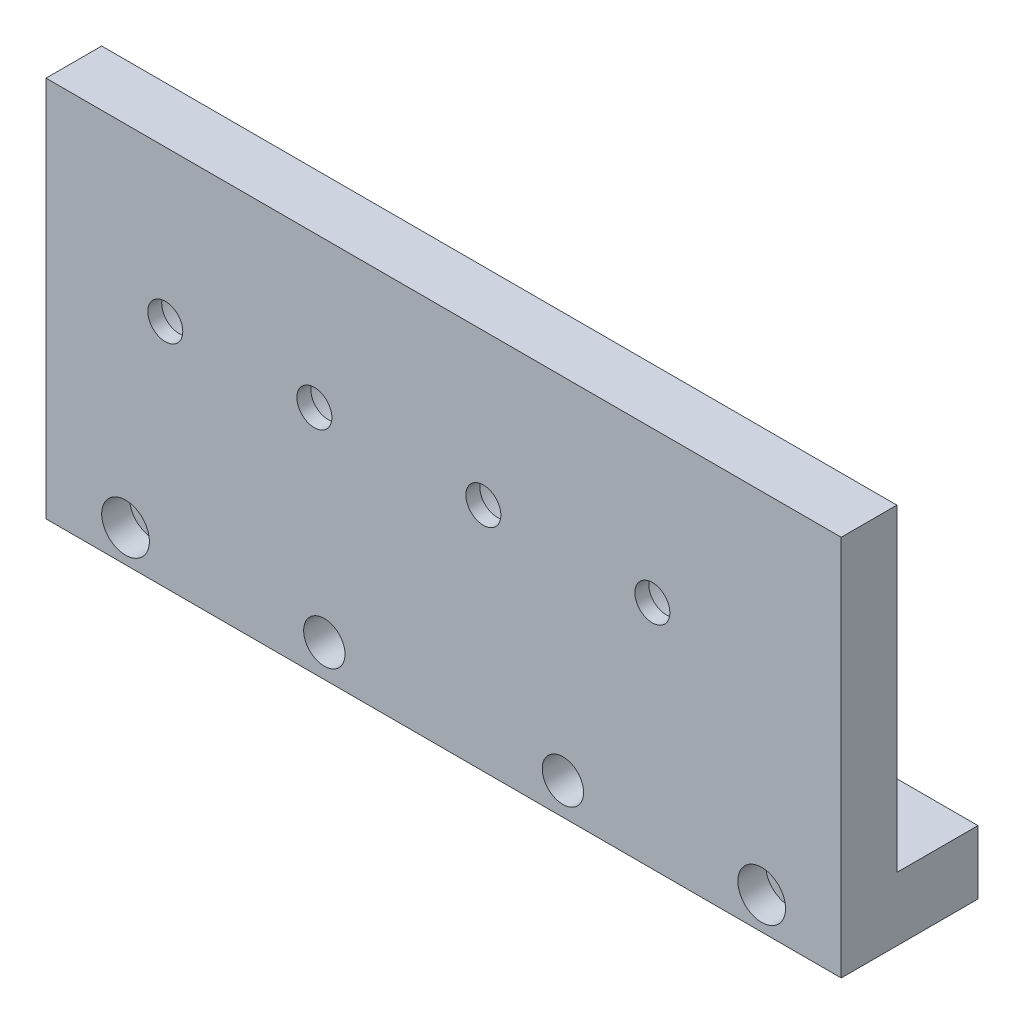
from build123d import *

# Parameters (mm, degrees)
SKETCH1_W           = 100
SKETCH1_H           = 48
BOSS_EXTRUDE1_DEPTH = 7
CUT_EXTRUDE1_REACH  = 113.144
SKETCH2_R           = 2.2
SKETCH3_W           = 100
SKETCH3_H           = 8
BOSS_EXTRUDE2_DEPTH = 10.2
SKETCH4_R           = 6.6
CUT_EXTRUDE2_DEPTH  = 5.25
SKETCH5_R           = 2.6
CUT_EXTRUDE3_DEPTH  = 7
SKETCH7_R           = 1.5
CUT_EXTRUDE4_DEPTH  = 112.391382072
CUT_EXTRUDE5_REACH  = 114.249
SKETCH8_R           = 1.7
SKETCH9_R           = 3
CUT_EXTRUDE6_DEPTH  = 3.5


with BuildPart() as part:
    # Sketch1 → Boss-Extrude1 (new body)
    with BuildSketch(Plane.XY):
        with Locations((50, 24)):
            Rectangle(SKETCH1_W, SKETCH1_H)
    extrude(amount=BOSS_EXTRUDE1_DEPTH)

    # Sketch2 → Cut-Extrude1 (cut, up to next)
    with BuildSketch(Plane.XY.offset(7), mode=Mode.PRIVATE) as cut_extrude1_sk1:
        with Locations((15, 29)):
            Circle(SKETCH2_R)
    cut_extrude1_tool1 = extrude(cut_extrude1_sk1.sketch, amount=-CUT_EXTRUDE1_REACH, mode=Mode.PRIVATE) & part.part
    # Sketch2 → Cut-Extrude1 (cut, up to next)
    with BuildSketch(Plane.XY.offset(7), mode=Mode.PRIVATE) as cut_extrude1_sk2:
        with Locations((33.75, 29)):
            Circle(SKETCH2_R)
    cut_extrude1_tool2 = extrude(cut_extrude1_sk2.sketch, amount=-CUT_EXTRUDE1_REACH, mode=Mode.PRIVATE) & part.part
    # Sketch2 → Cut-Extrude1 (cut, up to next)
    with BuildSketch(Plane.XY.offset(7), mode=Mode.PRIVATE) as cut_extrude1_sk3:
        with Locations((55, 29)):
            Circle(SKETCH2_R)
    cut_extrude1_tool3 = extrude(cut_extrude1_sk3.sketch, amount=-CUT_EXTRUDE1_REACH, mode=Mode.PRIVATE) & part.part
    # Sketch2 → Cut-Extrude1 (cut, up to next)
    with BuildSketch(Plane.XY.offset(7), mode=Mode.PRIVATE) as cut_extrude1_sk4:
        with Locations((76.25, 29)):
            Circle(SKETCH2_R)
    cut_extrude1_tool4 = extrude(cut_extrude1_sk4.sketch, amount=-CUT_EXTRUDE1_REACH, mode=Mode.PRIVATE) & part.part
    add(cut_extrude1_tool1.solids().sort_by_distance((15, 29, 7))[0], mode=Mode.SUBTRACT)
    add(cut_extrude1_tool2.solids().sort_by_distance((33.75, 29, 7))[0], mode=Mode.SUBTRACT)
    add(cut_extrude1_tool3.solids().sort_by_distance((55, 29, 7))[0], mode=Mode.SUBTRACT)
    add(cut_extrude1_tool4.solids().sort_by_distance((76.25, 29, 7))[0], mode=Mode.SUBTRACT)

    # Sketch3 → Boss-Extrude2 (add)
    with BuildSketch(Plane(origin=(0, 0, 0), x_dir=(-1, 0, 0), z_dir=(0, 0, -1))):
        with Locations((-50, 4)):
            Rectangle(SKETCH3_W, SKETCH3_H)
    extrude(amount=BOSS_EXTRUDE2_DEPTH)

    # Sketch4 → Cut-Extrude2 (cut)
    with BuildSketch(Plane(origin=(0, 0, 0), x_dir=(-1, 0, 0), z_dir=(0, 0, -1))):
        with Locations((-76.25, 29)):
            Circle(SKETCH4_R)
        with Locations((-55, 29)):
            Circle(SKETCH4_R)
        with Locations((-33.75, 29)):
            Circle(SKETCH4_R)
        with Locations((-15, 29)):
            Circle(SKETCH4_R)
    extrude(amount=-CUT_EXTRUDE2_DEPTH, mode=Mode.SUBTRACT)

    # Sketch5 → Cut-Extrude3 (cut)
    with BuildSketch(Plane.XY.offset(7)):
        with Locations((35.000022648, 4.052132501)):
            Circle(SKETCH5_R)
        with Locations((64.999977352, 4)):
            Circle(SKETCH5_R)
    extrude(amount=-CUT_EXTRUDE3_DEPTH, mode=Mode.SUBTRACT)

    # Sketch7 → Cut-Extrude4 (cut, through all)
    with BuildSketch(Plane.XY):
        with Locations((35.000022648, 4.052132501)):
            Circle(SKETCH7_R)
        with Locations((64.999977352, 4)):
            Circle(SKETCH7_R)
    extrude(amount=-CUT_EXTRUDE4_DEPTH, mode=Mode.SUBTRACT)

    # Sketch8 → Cut-Extrude5 (cut, up to next)
    with BuildSketch(Plane.XY.offset(7), mode=Mode.PRIVATE) as cut_extrude5_sk1:
        with Locations((10, 4.052132501)):
            Circle(SKETCH8_R)
    cut_extrude5_tool1 = extrude(cut_extrude5_sk1.sketch, amount=-CUT_EXTRUDE5_REACH, mode=Mode.PRIVATE) & part.part
    # Sketch8 → Cut-Extrude5 (cut, up to next)
    with BuildSketch(Plane.XY.offset(7), mode=Mode.PRIVATE) as cut_extrude5_sk2:
        with Locations((90, 4.052132501)):
            Circle(SKETCH8_R)
    cut_extrude5_tool2 = extrude(cut_extrude5_sk2.sketch, amount=-CUT_EXTRUDE5_REACH, mode=Mode.PRIVATE) & part.part
    add(cut_extrude5_tool1.solids().sort_by_distance((10, 4.052133, 7))[0], mode=Mode.SUBTRACT)
    add(cut_extrude5_tool2.solids().sort_by_distance((90, 4.052133, 7))[0], mode=Mode.SUBTRACT)

    # Sketch9 → Cut-Extrude6 (cut)
    with BuildSketch(Plane.XY.offset(7)):
        with Locations((10, 4.052132501)):
            Circle(SKETCH9_R)
        with Locations((90, 4.052132501)):
            Circle(SKETCH9_R)
    extrude(amount=-CUT_EXTRUDE6_DEPTH, mode=Mode.SUBTRACT)


solid = part.part
